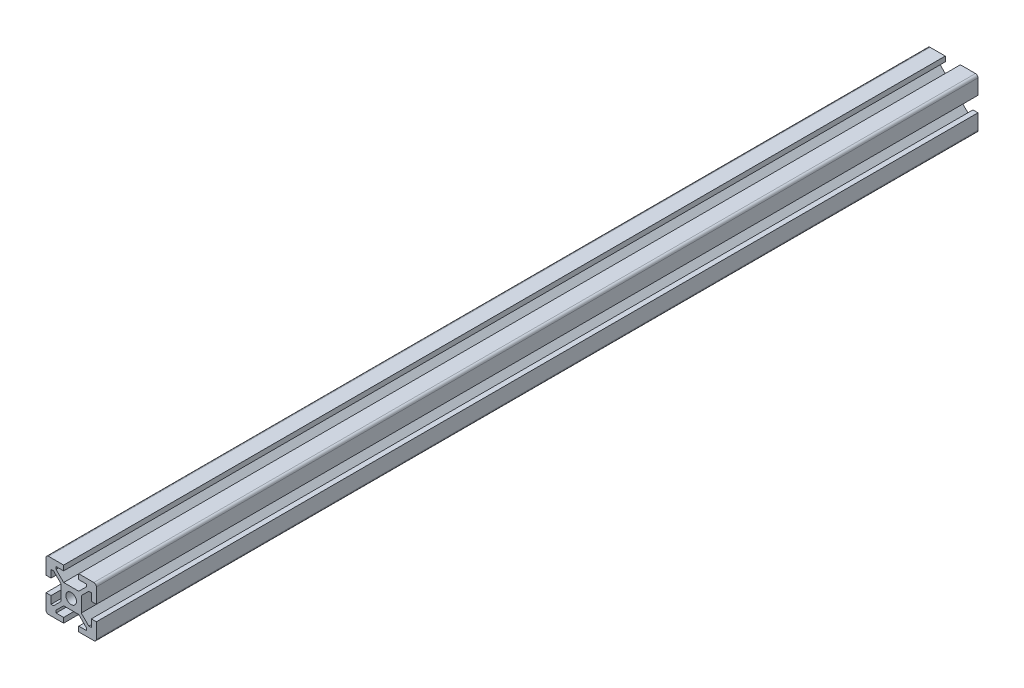
from build123d import *

# Parameters (mm, degrees)
SCHIZZO1_R                   = 2.1
ESTRUSIONE_ESTRUSIONE1_DEPTH = 350
RACCORDO1_R                  = 1


with BuildPart() as part:
    # Schizzo1 → Estrusione-Estrusione1 (new body)
    with BuildSketch(Plane.XY):
        Polygon((10, 3), (10, 10), (3, 10), (3, 8), (6, 8), (6, 7), (3, 4), (-3, 4), (-6, 7), (-6, 8), (-3, 8), (-3, 10), (-10, 10), (-10, 3), (-8, 3), (-8, 6), (-7, 6), (-4, 3), (-4, -3), (-7, -6), (-8, -6), (-8, -3), (-10, -3), (-10, -10), (-3, -10), (-3, -8), (-6, -8), (-6, -7), (-3, -4), (3, -4), (6, -7), (6, -8), (3, -8), (3, -10), (10, -10), (10, -3), (8, -3), (8, -6), (7, -6), (4, -3), (4, 3), (7, 6), (8, 6), (8, 3), align=None)
        Circle(SCHIZZO1_R, mode=Mode.SUBTRACT)
    extrude(amount=ESTRUSIONE_ESTRUSIONE1_DEPTH)

    # Raccordo1
    raccordo1_edges = [part.edges().sort_by_distance(p)[0] for p in [
        (-10, -10, 175),
        (10, -10, 175),
        (-10, 10, 175),
        (10, 10, 175),
    ]]
    fillet(raccordo1_edges, radius=RACCORDO1_R)


solid = part.part
